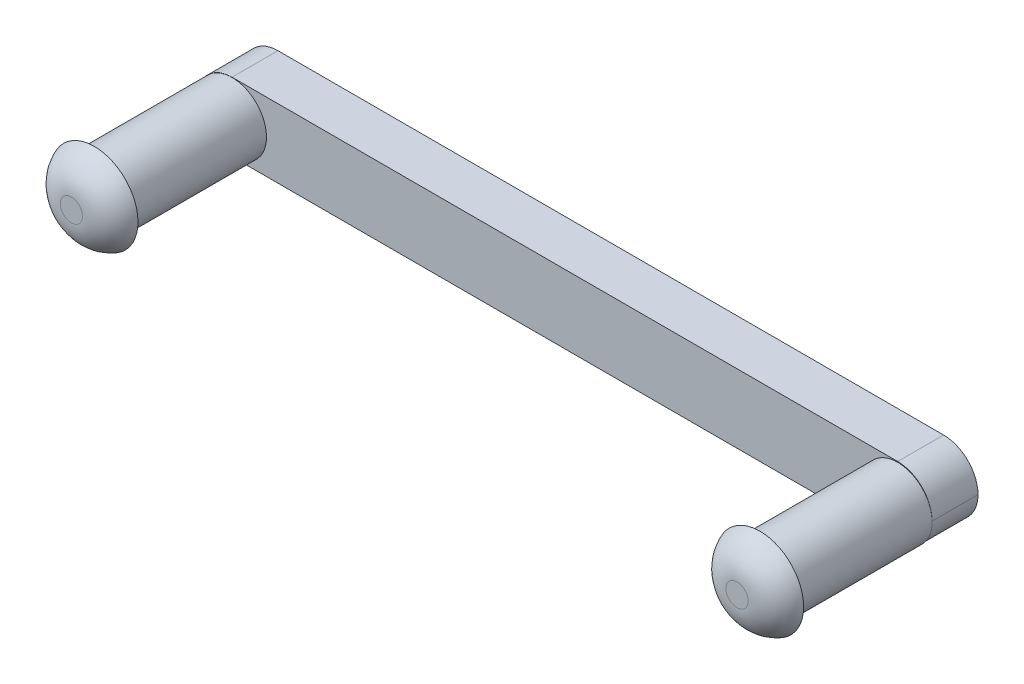
from build123d import *

# Parameters (mm, degrees)
ESQUISSE1_W        = 32
ESQUISSE1_H        = 3
BOSS_EXTRU_2_DEPTH = 2
ESQUISSE4_R        = 1.5
BOSS_EXTRU_3_DEPTH = 6
ESQUISSE5_R        = 1.9
BOSS_EXTRU_4_DEPTH = 1
CONG_13_R          = 1.5
CONG_14_R          = 1.5
CONG_16_R          = 1.5
CONG_17_R          = 1.5


with BuildPart() as part:
    # Esquisse1 → Boss.-Extru.2 (new body)
    with BuildSketch(Plane(origin=(-13.705479482, 0.648434545, 0), x_dir=(1, 0, 0), z_dir=(0, 0, 1))):
        with Locations((47.215800187, 12.683032093)):
            Rectangle(ESQUISSE1_W, ESQUISSE1_H)
    extrude(amount=BOSS_EXTRU_2_DEPTH)

    # Esquisse4 → Boss.-Extru.3 (add)
    with BuildSketch(Plane(origin=(-13.705479482, 4.052004393, 2), x_dir=(1, 0, 0), z_dir=(0, 0, 1))):
        with Locations(Location((32.71685212, 9.269475593, 0), (0, 0, 263.384796373))):
            Circle(ESQUISSE4_R)
        with Locations(Location((61.71685212, 9.250376763, 0), (0, 0, 258.698543871))):
            Circle(ESQUISSE4_R)
    extrude(amount=BOSS_EXTRU_3_DEPTH)

    # Esquisse5 → Boss.-Extru.4 (add)
    with BuildSketch(Plane(origin=(-13.705479482, 4.052004393, 8), x_dir=(1, 0, 0), z_dir=(0, 0, 1))):
        with Locations((32.71685212, 9.269475593)):
            Circle(ESQUISSE5_R)
        with Locations((61.71685212, 9.250376763)):
            Circle(ESQUISSE5_R)
    extrude(amount=BOSS_EXTRU_4_DEPTH)

    # Congé13
    # the kernel refuses this fillet: 1.5 mm, written as the material it takes off along each edge
    with BuildSketch(Plane(origin=(49.510320705, 14.831466639, -3.75), x_dir=(0, -1, 0), z_dir=(0, 0, 1)), Plane(origin=(49.510320705, 11.831466639, -3.75), x_dir=(-1, 0, 0), z_dir=(0, 0, 1))) as cong_13_piece_1:
        with BuildLine():
            CenterArc((CONG_13_R, -CONG_13_R), CONG_13_R, 90, 90)
            Line((0, -CONG_13_R), (0, 0))
            Line((0, 0), (CONG_13_R, 0))
        make_face()
    extrude(amount=5.75, mode=Mode.SUBTRACT)

    # Congé14
    # the kernel refuses this fillet: 1.5 mm, written as the material it takes off along each edge
    with BuildSketch(Plane(origin=(17.510320705, 11.831466639, -3.75), x_dir=(0, 1, 0), z_dir=(0, 0, 1))) as cong_14_piece_1:
        with BuildLine():
            CenterArc((CONG_14_R, -CONG_14_R), CONG_14_R, 90, 90)
            Line((0, -CONG_14_R), (0, 0))
            Line((0, 0), (CONG_14_R, 0))
        make_face()
    extrude(amount=5.75, mode=Mode.SUBTRACT)
    with BuildSketch(Plane(origin=(17.510320705, 14.831466639, -3.75), x_dir=(0, -1, 0), z_dir=(0, 0, 1))) as cong_14_piece_2:
        with BuildLine():
            CenterArc((CONG_14_R, CONG_14_R), CONG_14_R, 180, 90)
            Line((0, CONG_14_R), (0, 0))
            Line((0, 0), (CONG_14_R, 0))
        make_face()
    extrude(amount=9.5, mode=Mode.SUBTRACT)

    # Congé16
    # the kernel refuses this fillet: 1.5 mm, written as the material it takes off along each edge
    with BuildSketch(Plane(origin=(48.011372638, 13.302381156, 9), x_dir=(1, 0, 0), z_dir=(0, -1, 0))) as cong_16_piece_1:
        with BuildLine():
            CenterArc((0.485786438, -1.5), CONG_16_R, 19.471220634, 70.528779366)
            Line((0.485786438, 0), (0.485786438, 0.03))
            Line((0.485786438, 0.03), (1.9, 0.03))
            Line((1.9, 0.03), (1.93, 0))
            ThreePointArc((1.93, 0), (1.93, -0.5), (1.928284271, -0.99))
            Line((1.928284271, -0.99), (1.9, -1))
        make_face()
    revolve(axis=Axis((48.011372638, 13.302381156, 9), (0, 0, 1)), mode=Mode.SUBTRACT)

    # Congé17
    # the kernel refuses this fillet: 1.5 mm, written as the material it takes off along each edge
    with BuildSketch(Plane(origin=(19.011372638, 13.321479986, 9), x_dir=(1, 0, 0), z_dir=(0, -1, 0))) as cong_17_piece_1:
        with BuildLine():
            CenterArc((0.485786438, -1.5), CONG_17_R, 19.471220634, 70.528779366)
            Line((0.485786438, 0), (0.485786438, 0.03))
            Line((0.485786438, 0.03), (1.9, 0.03))
            Line((1.9, 0.03), (1.93, 0))
            ThreePointArc((1.93, 0), (1.93, -0.5), (1.928284271, -0.99))
            Line((1.928284271, -0.99), (1.9, -1))
        make_face()
    revolve(axis=Axis((19.011372638, 13.321479986, 9), (0, 0, 1)), mode=Mode.SUBTRACT)


solid = part.part
